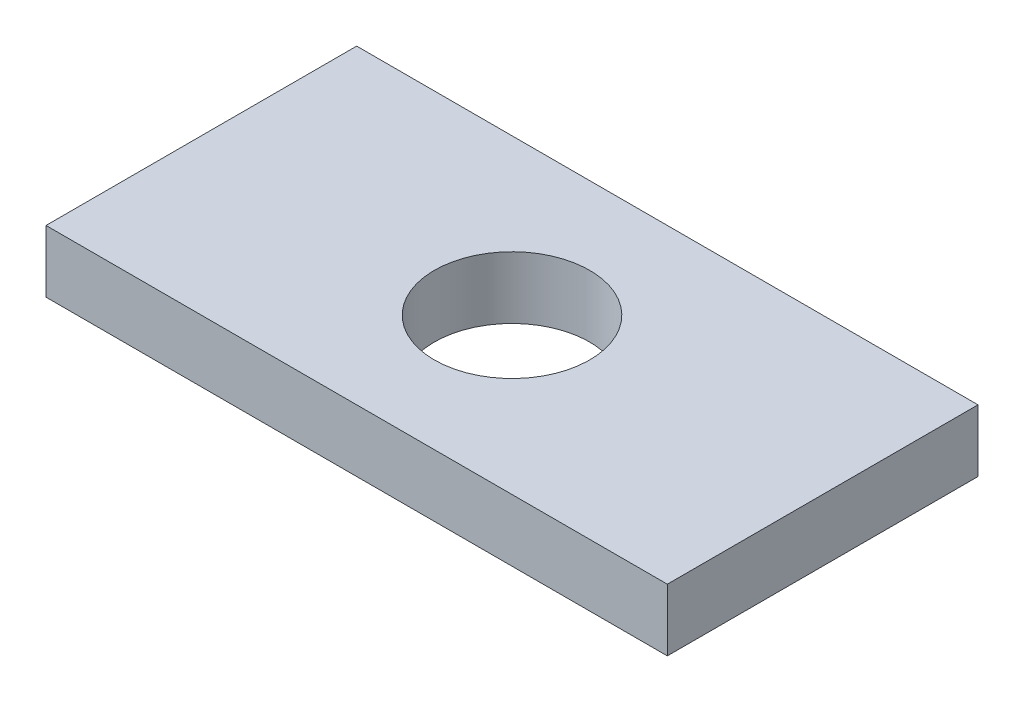
from build123d import *

# Parameters (mm, degrees)
SKETCH_1_W          = 40
SKETCH_1_H          = 20
EXTRUDE_1_DEPTH     = 4
SKETCH_2_R          = 5
CUT_EXTRUDE_1_DEPTH = 45.899888641


with BuildPart() as part:
    # Эскиз1 → Бобышка-Вытянуть1 (new body)
    with BuildSketch(Plane(origin=(0, 0, 0), x_dir=(1, 0, 0), z_dir=(0, 1, 0))):
        with Locations((20, 10)):
            Rectangle(SKETCH_1_W, SKETCH_1_H)
    extrude(amount=EXTRUDE_1_DEPTH)

    # Эскиз2 → Вырез-Вытянуть1 (cut, through all)
    with BuildSketch(Plane(origin=(0, 4, 0), x_dir=(1, 0, 0), z_dir=(0, 1, 0))):
        with Locations((20, 10)):
            Circle(SKETCH_2_R)
    extrude(amount=-CUT_EXTRUDE_1_DEPTH, mode=Mode.SUBTRACT)


solid = part.part
